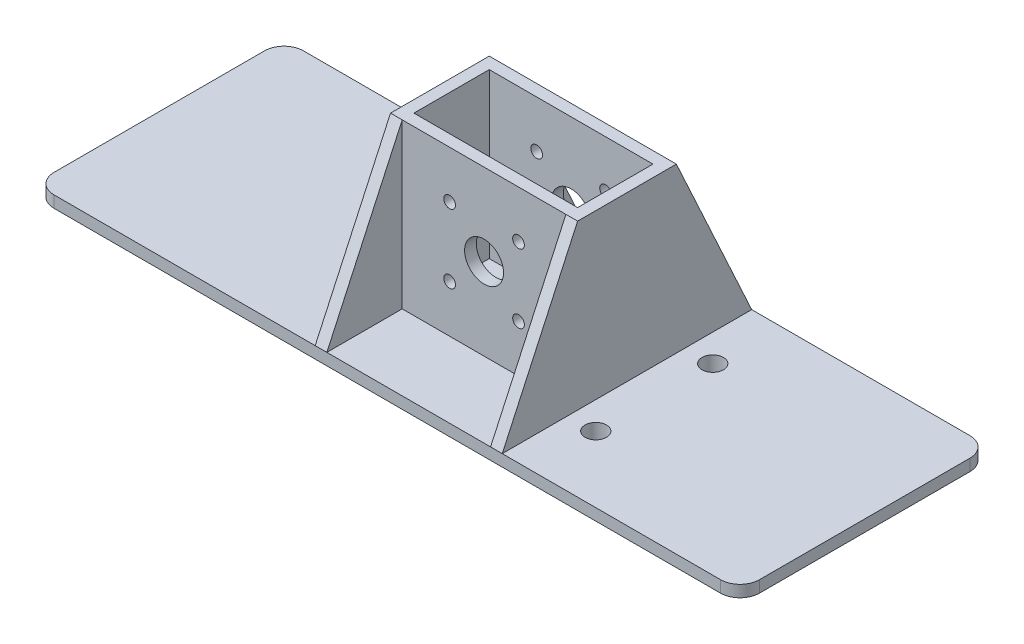
from build123d import *

# Parameters (mm, degrees)
BOSS_EXTRUDE1_DEPTH     = 3
SKETCH2_R               = 2.75
CUT_EXTRUDE1_DEPTH      = 97.037752993
SKETCH9_R               = 4.75
SKETCH9_R_2             = 2.75
BOSS_EXTRUDE4_DEPTH     = 4.5
SKETCH11_W              = 42
SKETCH11_H              = 19.333333334
BOSS_EXTRUDE6_DEPTH     = 42
CUT_EXTRUDE2_DEPTH      = 120.519872825
CUT_EXTRUDE2_DEPTH_BACK = 120.519872825
CUT_EXTRUDE3_DEPTH      = 111.500502764
CUT_EXTRUDE3_DEPTH_BACK = 111.500502764
SKETCH13_R              = 5
SKETCH13_R_2            = 1.5


with BuildPart() as part:
    # Sketch1 → Boss-Extrude1 (new body)
    with BuildSketch(Plane(origin=(0, 0, 0), x_dir=(1, 0, 0), z_dir=(0, 1, 0))):
        with BuildLine():
            Line((85.5, 32), (-85.5, 32))
            ThreePointArc((-85.5, 32), (-89.035533906, 30.535533906), (-90.5, 27))
            Line((-90.5, 27), (-90.5, -27))
            ThreePointArc((-90.5, -27), (-89.035533906, -30.535533906), (-85.5, -32))
            Line((-85.5, -32), (85.5, -32))
            ThreePointArc((85.5, -32), (89.035533906, -30.535533906), (90.5, -27))
            Line((90.5, -27), (90.5, 27))
            ThreePointArc((90.5, 27), (89.035533906, 30.535533906), (85.5, 32))
        make_face()
    extrude(amount=BOSS_EXTRUDE1_DEPTH)

    # Sketch2 → Cut-Extrude1 (cut, through all)
    with BuildSketch(Plane(origin=(0, 3, 0), x_dir=(1, 0, 0), z_dir=(0, 1, 0))):
        with Locations((36.5, -15)):
            Circle(SKETCH2_R)
        with Locations((36.5, 15)):
            Circle(SKETCH2_R)
        with Locations((-25.5, 0)):
            Circle(SKETCH2_R)
    extrude(amount=-CUT_EXTRUDE1_DEPTH, mode=Mode.SUBTRACT)

    # Sketch9 → Boss-Extrude4 (add)
    # profile 1 of 3: a face of its own
    with BuildSketch(Plane.XZ):
        with Locations((-25.5, 0)):
            Circle(SKETCH9_R)
        with Locations((-25.5, 0)):
            Circle(SKETCH9_R_2, mode=Mode.SUBTRACT)
    # profile 2 of 3: a face of its own
    with BuildSketch(Plane.XZ):
        with Locations((36.5, -15)):
            Circle(SKETCH9_R)
        with Locations((36.5, -15)):
            Circle(SKETCH9_R_2, mode=Mode.SUBTRACT)
    # profile 3 of 3: a face of its own
    with BuildSketch(Plane.XZ):
        with Locations((36.5, 15)):
            Circle(SKETCH9_R)
        with Locations((36.5, 15)):
            Circle(SKETCH9_R_2, mode=Mode.SUBTRACT)
    extrude(amount=BOSS_EXTRUDE4_DEPTH)

    # Sketch11 → Boss-Extrude6 (add)
    with BuildSketch(Plane(origin=(0, 3, 0), x_dir=(1, 0, 0), z_dir=(0, 1, 0))):
        Polygon((-18.5, 32), (-15.5, 32), (-15.5, 12.666666667), (26.5, 12.666666667), (26.5, 32), (29.5, 32), (29.5, -32), (26.5, -32), (26.5, -12.666666667), (-15.5, -12.666666667), (-15.5, -32), (-18.5, -32), align=None)
        with Locations((5.5, 0)):
            Rectangle(SKETCH11_W, SKETCH11_H, mode=Mode.SUBTRACT)
    extrude(amount=BOSS_EXTRUDE6_DEPTH)

    # Sketch12 → Cut-Extrude2 (cut, two sides: drawn at the far end of the back side and taken through both)
    with BuildSketch(Plane(origin=(-15.5, 0, 0), x_dir=(0, 0, -1), z_dir=(1, 0, 0)).offset(-CUT_EXTRUDE2_DEPTH_BACK)):
        Polygon((-12.666666667, 45), (-32, 3), (-32, 45), align=None)
        Polygon((12.666666667, 45), (32, 3), (32, 45), align=None)
    extrude(amount=CUT_EXTRUDE2_DEPTH + CUT_EXTRUDE2_DEPTH_BACK, mode=Mode.SUBTRACT)

    # Sketch13 → Cut-Extrude3 (cut, two sides: drawn at the far end of the back side and taken through both)
    with BuildSketch(Plane.XY.offset(12.666666667).offset(-CUT_EXTRUDE3_DEPTH_BACK)):
        with Locations((5.5, 24)):
            Circle(SKETCH13_R)
        with Locations((-3.338834765, 15.161165235)):
            Circle(SKETCH13_R_2)
        with Locations((-3.338834765, 32.838834765)):
            Circle(SKETCH13_R_2)
        with Locations((14.338834765, 15.161165235)):
            Circle(SKETCH13_R_2)
        with Locations((14.338834765, 32.838834765)):
            Circle(SKETCH13_R_2)
    extrude(amount=CUT_EXTRUDE3_DEPTH + CUT_EXTRUDE3_DEPTH_BACK, mode=Mode.SUBTRACT)


solid = part.part
